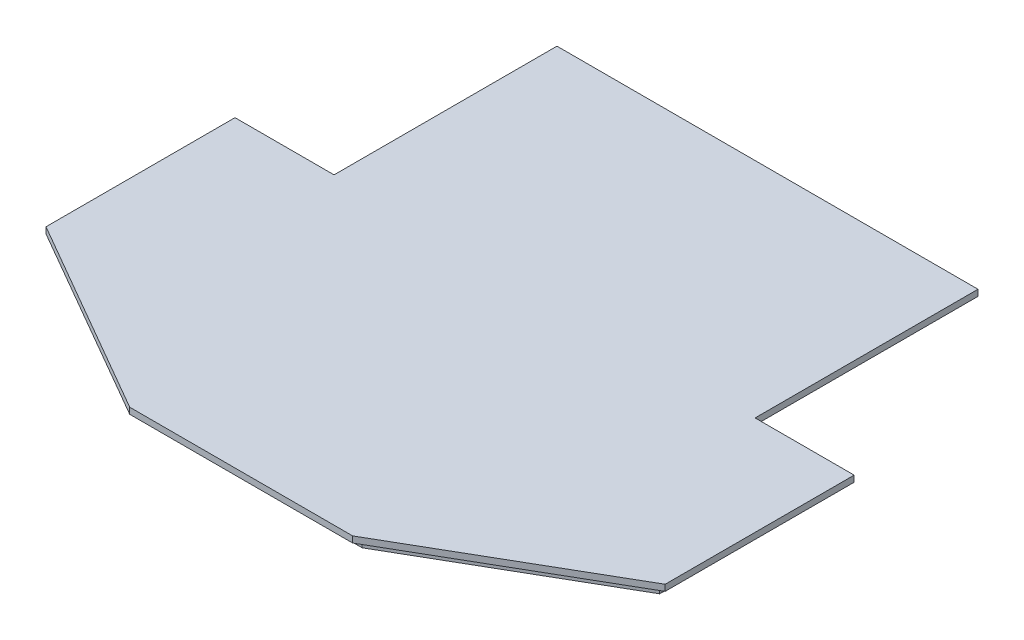
from build123d import *

# Parameters (mm, degrees)
EXTRUDE_1_DEPTH = 2
EXTRUDE_2_DEPTH = 4
SHELL_START     = -4
SHELL_4_DEPTH   = 2


with BuildPart() as part:
    # 草图1 → 凸台-拉伸1 (new body)
    with BuildSketch(Plane(origin=(0, 0, 0), x_dir=(1, 0, 0), z_dir=(0, 1, 0))):
        Polygon((-100, -133.049582772), (-36, -170), (36, -170), (100, -133.049582772), (100, -72), (68, -72), (68, 0), (-68, 0), (-68, -72), (-100, -72), align=None)
    extrude(amount=EXTRUDE_1_DEPTH)

    # 草图2 → 凸台-拉伸2 (add)
    with BuildSketch(Plane(origin=(0, 0, 0), x_dir=(1, 0, 0), z_dir=(0, 1, 0))):
        Polygon((95.8, -76.2), (63.8, -76.2), (63.8, -4.2), (-63.8, -4.2), (-63.8, -76.2), (-95.8, -76.2), (-95.8, -130.624711641), (-34.874613392, -165.8), (34.874613392, -165.8), (95.8, -130.624711641), align=None)
    extrude(amount=-EXTRUDE_2_DEPTH)

    # 抽壳4: read off the stored shape, not the designer's step
    # 抽壳4 outline → 抽壳4 (cut)
    with BuildSketch(Plane(origin=(0, 0, 0), x_dir=(1, 0, 0), z_dir=(0, 1, 0)).offset(SHELL_START)):
        Polygon((33.802816622, -161.8), (91.8, -128.315310565), (91.8, -80.2), (59.8, -80.2), (59.8, -8.2), (-59.8, -8.2), (-59.8, -80.2), (-91.8, -80.2), (-91.8, -128.315310565), (-33.802816622, -161.8), align=None)
    extrude(amount=SHELL_4_DEPTH, mode=Mode.SUBTRACT)


solid = part.part
